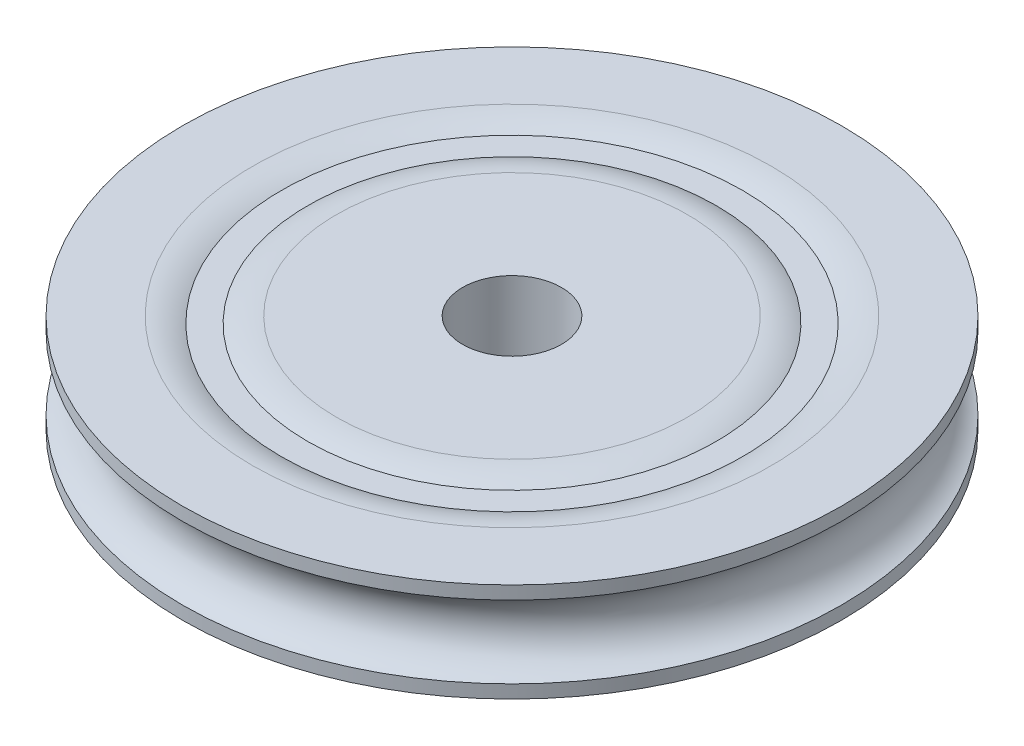
from build123d import *

# Parameters (mm, degrees)
FILLET1_R          = 10
FILLET2_R          = 10
FILLET3_R          = 10
FILLET4_R          = 10
SKETCH3_R          = 7.5
CUT_EXTRUDE1_DEPTH = 73.284161495


with BuildPart() as part:
    # Sketch2 → Revolve1 (revolve)
    with BuildSketch(Plane(origin=(0, 0, 0), x_dir=(0, 0, -1), z_dir=(1, 0, 0))):
        with BuildLine():
            Line((0, 7.5), (-31, 7.5))
            Line((-31, 7.5), (-31, 6.5))
            Line((-31, 6.5), (-35, 6.5))
            Line((-35, 6.5), (-35, 7.5))
            Line((-35, 7.5), (-50, 7.5))
            Line((-50, 7.5), (-50, 5.5))
            ThreePointArc((-50, 5.5), (-46.147650045, 0), (-50, -5.5))
            Line((-50, -5.5), (-50, -7.5))
            Line((-50, -7.5), (-35, -7.5))
            Line((-35, -7.5), (-35, -6.5))
            Line((-35, -6.5), (-31, -6.5))
            Line((-31, -6.5), (-31, -7.5))
            Line((-31, -7.5), (0, -7.5))
            Line((0, -7.5), (0, 7.5))
        make_face()
    revolve(axis=Axis((0, 55.434917487, 0), (0, -1, 0)))

    # Fillet1
    # the kernel refuses this fillet: 10 mm, written as the material it takes off along each edge
    with BuildSketch(Plane(origin=(0, 7.5, 0), x_dir=(0, 0, 1), z_dir=(1, 0, 0))) as fillet1_piece_1:
        with BuildLine():
            CenterArc((39.358898944, 10), FILLET1_R, 244.158067237, 25.841932763)
            Line((39.358898944, 0), (39.358898944, -0.2))
            Line((39.358898944, -0.2), (35, -0.2))
            Line((35, -0.2), (34.8, 0))
            ThreePointArc((34.8, 0), (34.8, 0.5), (34.912822021, 0.82))
            Line((34.912822021, 0.82), (35, 1))
        make_face()
    revolve(axis=Axis((0, 7.5, 0), (0, -1, 0)), mode=Mode.SUBTRACT)

    # Fillet2
    # the kernel refuses this fillet: 10 mm, written as the material it takes off along each edge
    with BuildSketch(Plane(origin=(0, 7.5, 0), x_dir=(0, 0, 1), z_dir=(1, 0, 0))) as fillet2_piece_1:
        with BuildLine():
            CenterArc((26.641101056, 10), FILLET2_R, 270, 25.841932763)
            Line((26.641101056, 0), (26.641101056, -0.2))
            Line((26.641101056, -0.2), (31, -0.2))
            Line((31, -0.2), (31.2, 0))
            ThreePointArc((31.2, 0), (31.2, 0.5), (31.087177979, 0.82))
            Line((31.087177979, 0.82), (31, 1))
        make_face()
    revolve(axis=Axis((0, 7.5, 0), (0, -1, 0)), mode=Mode.SUBTRACT)

    # Fillet3
    # the kernel refuses this fillet: 10 mm, written as the material it takes off along each edge
    with BuildSketch(Plane(origin=(0, -7.5, 0), x_dir=(0, 0, 1), z_dir=(1, 0, 0))) as fillet3_piece_1:
        with BuildLine():
            CenterArc((39.358898944, -10), FILLET3_R, 90, 25.841932763)
            Line((35, -1), (34.912822021, -0.82))
            ThreePointArc((34.912822021, -0.82), (34.8, -0.5), (34.8, 0))
            Line((34.8, 0), (35, 0.2))
            Line((35, 0.2), (39.358898944, 0.2))
            Line((39.358898944, 0.2), (39.358898944, 0))
        make_face()
    revolve(axis=Axis((0, -7.5, 0), (0, -1, 0)), mode=Mode.SUBTRACT)

    # Fillet4
    # the kernel refuses this fillet: 10 mm, written as the material it takes off along each edge
    with BuildSketch(Plane(origin=(0, -7.5, 0), x_dir=(0, 0, 1), z_dir=(1, 0, 0))) as fillet4_piece_1:
        with BuildLine():
            CenterArc((26.641101056, -10), FILLET4_R, 64.158067237, 25.841932763)
            Line((26.641101056, 0), (26.641101056, 0.2))
            Line((26.641101056, 0.2), (31, 0.2))
            Line((31, 0.2), (31.2, 0))
            ThreePointArc((31.2, 0), (31.2, -0.5), (31.087177979, -0.82))
            Line((31.087177979, -0.82), (31, -1))
        make_face()
    revolve(axis=Axis((0, -7.5, 0), (0, -1, 0)), mode=Mode.SUBTRACT)

    # Sketch3 → Cut-Extrude1 (cut, through all)
    with BuildSketch(Plane.XZ.offset(7.5)):
        with Locations(Location((0, 0, 0), (0, 0, 270))):
            Circle(SKETCH3_R)
    extrude(amount=-CUT_EXTRUDE1_DEPTH, mode=Mode.SUBTRACT)


solid = part.part
